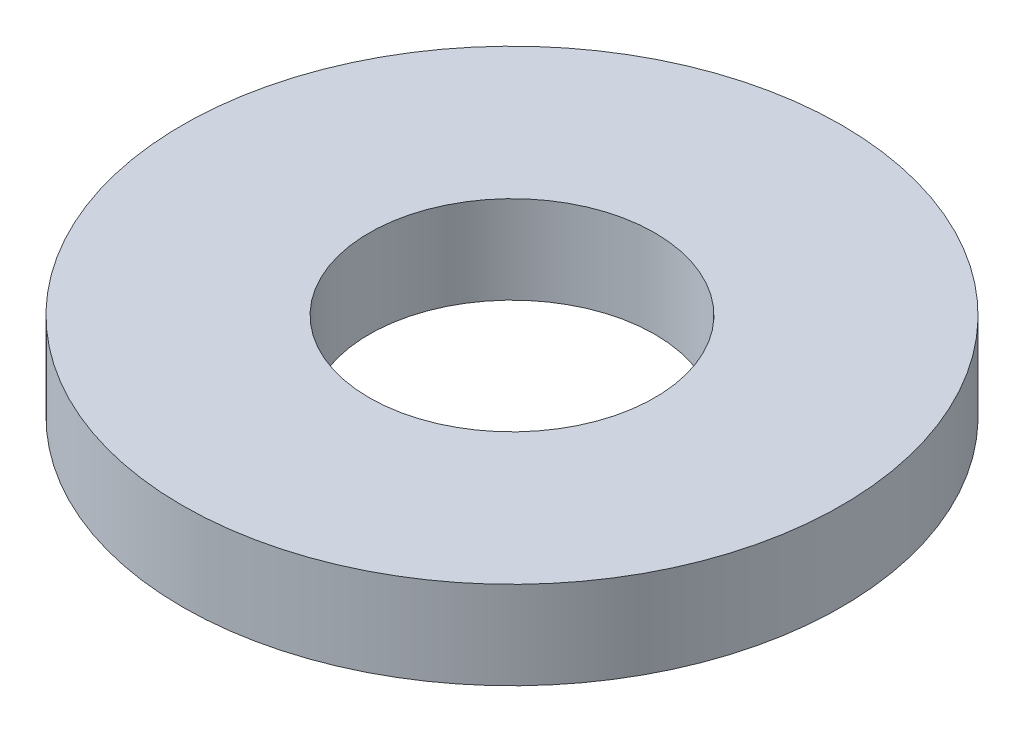
from build123d import *

# Parameters (mm, degrees)
SKETCH1_R           = 75
BOSS_EXTRUDE1_DEPTH = 20
SKETCH2_R           = 32.5
CUT_EXTRUDE1_DEPTH  = 108.935165725


with BuildPart() as part:
    # Sketch1 → Boss-Extrude1 (new body)
    with BuildSketch(Plane(origin=(0, 0, 0), x_dir=(1, 0, 0), z_dir=(0, 1, 0))):
        Circle(SKETCH1_R)
    extrude(amount=BOSS_EXTRUDE1_DEPTH)

    # Sketch2 → Cut-Extrude1 (cut, through all)
    with BuildSketch(Plane(origin=(0, 0, 0), x_dir=(1, 0, 0), z_dir=(0, 1, 0))):
        Circle(SKETCH2_R)
    extrude(amount=CUT_EXTRUDE1_DEPTH, mode=Mode.SUBTRACT)


solid = part.part
